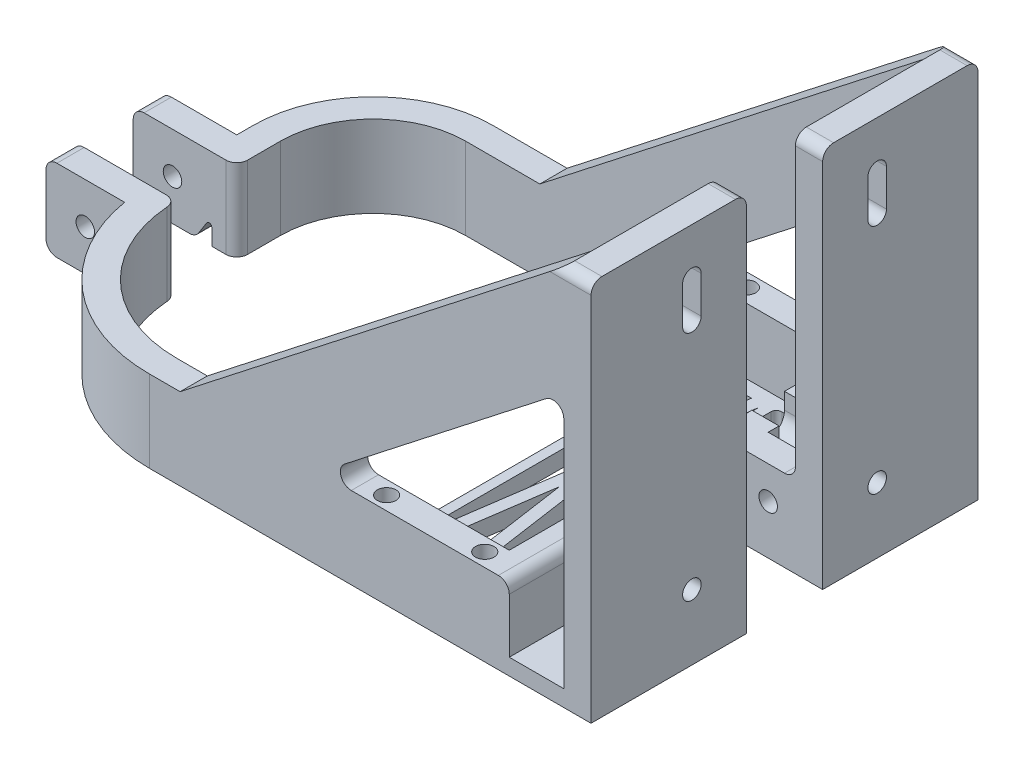
from build123d import *

# Parameters (mm, degrees)
BOSS_EXTRUDE1_DEPTH            = 15
BOSS_EXTRUDE1_2_DEPTH          = 15
BOSS_EXTRUDE2_DEPTH            = 3
CUT_EXTRUDE1_DEPTH             = 73.873177507
CUT_EXTRUDE1_DEPTH_BACK        = 73.873177507
BOSS_EXTRUDE3_START            = -28.5
BOSS_EXTRUDE3_DEPTH            = 28.5
BOSS_EXTRUDE4_DEPTH            = 5
CUT_EXTRUDE2_REACH             = 149.598
SKETCH10_R                     = 1.7
CUT_EXTRUDE2_DIRECTION_2_DEPTH = 148.598272348
MIRROR1_START                  = 57.5
MIRROR1_OUTLINE_W              = 70
MIRROR1_OUTLINE_H              = 42.5
MIRROR1_OUTLINE_R              = 1.7
MIRROR1_DEPTH                  = 5
MIRROR1_START_2                = 47.5
MIRROR1_2_OUTLINE_W            = 3
MIRROR1_2_OUTLINE_H            = 23.5
MIRROR1_2_OUTLINE_H_2          = 14
MIRROR1_2_DEPTH                = 10
MIRROR1_START_3                = -35.5
MIRROR1_3_DEPTH                = 5
CUT_EXTRUDE3_REACH             = 149.598
CUT_EXTRUDE3_DIRECTION_2_DEPTH = 148.598272348
CUT_EXTRUDE4_REACH             = 133.093
CUT_EXTRUDE4_DIRECTION_2_DEPTH = 1
F_2MMFILLET_R                  = 2
F_1MMFILLET_R                  = 1
CUT_EXTRUDE5_DEPTH             = 105.509568001
CUT_EXTRUDE5_DEPTH_BACK        = 105.509568001
SKETCH13_R                     = 1.7
FILLET4_R                      = 2
SKETCH14_R                     = 1.7
CUT_EXTRUDE6_DEPTH             = 15


with BuildPart() as part:
    # Sketch1 → Boss-Extrude1 (new body)
    with BuildSketch(Plane(origin=(0, 0, 0), x_dir=(1, 0, 0), z_dir=(0, 1, 0))):
        with BuildLine():
            Line((-43.5, 5.499997868), (-43.5, 13.5))
            ThreePointArc((-43.5, 13.5), (-38.52081528, 25.52081528), (-26.5, 30.5))
            Line((-26.5, 30.5), (0, 30.5))
            Line((0, 30.5), (42.5, 30.5))
            Line((42.5, 30.5), (42.5, 7))
            Line((42.5, 7), (43.5, 7))
            Line((43.5, 7), (57.5, 7))
            Line((57.5, 7), (57.5, 12))
            Line((57.5, 12), (47.5, 12))
            Line((47.5, 12), (47.5, 35.5))
            Line((47.5, 35.5), (0, 35.5))
            Line((0, 35.5), (-26.5, 35.5))
            ThreePointArc((-26.5, 35.5), (-42.056349186, 29.056349186), (-48.5, 13.5))
            Line((-48.5, 13.5), (-48.5, 10.499997868))
            Line((-48.5, 10.499997868), (-62.5, 10.499997868))
            Line((-62.5, 10.499997868), (-62.5, 5.499997868))
            Line((-62.5, 5.499997868), (-48.5, 5.499997868))
            Line((-48.5, 5.499997868), (-43.5, 5.499997868))
        make_face()
    extrude(amount=BOSS_EXTRUDE1_DEPTH)



with BuildPart() as body_2:
    # Sketch1 → Boss-Extrude1 2 (new body)
    with BuildSketch(Plane(origin=(0, 0, 0), x_dir=(1, 0, 0), z_dir=(0, 1, 0))):
        with BuildLine():
            Line((42.5, -7), (42.5, -30.5))
            Line((42.5, -30.5), (0, -30.5))
            Line((0, -30.5), (-18.5, -30.5))
            ThreePointArc((-18.5, -30.5), (-36.177670284, -23.177668776), (-43.5, -5.499997868))
            Line((-43.5, -5.499997868), (-48.5, -5.499997441))
            Line((-48.5, -5.499997441), (-62.5, -5.499997868))
            Line((-62.5, -5.499997868), (-62.5, -10.499997868))
            Line((-62.5, -10.499997868), (-48.5, -10.499997868))
            Line((-48.5, -10.499997868), (-48.080399276, -10.499997868))
            ThreePointArc((-48.080399276, -10.499997868), (-37.864917557, -28.412877777), (-18.5, -35.5))
            Line((-18.5, -35.5), (0, -35.5))
            Line((0, -35.5), (47.5, -35.5))
            Line((47.5, -35.5), (47.5, -12))
            Line((47.5, -12), (57.5, -12))
            Line((57.5, -12), (57.5, -7))
            Line((57.5, -7), (43.5, -7))
            Line((43.5, -7), (42.5, -7))
        make_face()
    extrude(amount=BOSS_EXTRUDE1_2_DEPTH)


with BuildPart() as part_1:
    add(part.part)

    add(body_2.part)  # Boss-Extrude2 merges body 2
    # Sketch2 → Boss-Extrude2 (add)
    with BuildSketch(Plane(origin=(0, 0, 0), x_dir=(1, 0, 0), z_dir=(0, 1, 0))):
        with BuildLine():
            Line((40.5, -28.5), (32.5, -28.5))
            Line((32.5, -28.5), (32.5, 28.5))
            Line((32.5, 28.5), (40.5, 28.5))
            Line((40.5, 28.5), (40.5, 7))
            Line((40.5, 7), (42.5, 7))
            Line((42.5, 7), (42.5, 30.5))
            Line((42.5, 30.5), (7.5, 30.5))
            Line((7.5, 30.5), (17.5, 28))
            Line((17.5, 28), (17.5, -28.5))
            Line((17.5, -28.5), (-17.5, -28.5))
            ThreePointArc((-17.5, -28.5), (-26.470562378, -26.677447143), (-34.018685261, -21.498786191))
            Line((-34.018685261, -21.498786191), (-35.862976187, -23.486857923))
            ThreePointArc((-35.862976187, -23.486857923), (-27.862920269, -28.680503101), (-18.5, -30.5))
            Line((-18.5, -30.5), (7.5, -30.5))
            Line((7.5, -30.5), (42.5, -30.5))
            Line((42.5, -30.5), (42.5, -7))
            Line((42.5, -7), (40.5, -7))
            Line((40.5, -7), (40.5, -28.5))
        make_face()
    extrude(amount=BOSS_EXTRUDE2_DEPTH)

    # Sketch5 → Cut-Extrude1 (cut, two sides: drawn at the far end of the back side and taken through both)
    with BuildSketch(Plane(origin=(0, 3, 0), x_dir=(1, 0, 0), z_dir=(0, 1, 0)).offset(-CUT_EXTRUDE1_DEPTH_BACK)):
        Polygon((23.254100065, -0.25), (19.3, 27), (19.3, -27.5), align=None)
        Polygon((21.435473806, 27.874767456), (25, 3.309547254), (28.564526194, 27.874767456), align=None)
        Polygon((21.435473806, -28.374767456), (25, -3.809547254), (28.564526194, -28.374767456), align=None)
        Polygon((30.7, -27.5), (26.745899935, -0.25), (30.7, 27), align=None)
    extrude(amount=CUT_EXTRUDE1_DEPTH + CUT_EXTRUDE1_DEPTH_BACK, mode=Mode.SUBTRACT)

    # Sketch6 → Boss-Extrude3 (add)
    with BuildSketch(Plane.XY.offset(35.5).offset(BOSS_EXTRUDE3_START)):
        Polygon((47.5, 0), (62.5, 0), (62.5, 70), (57.5, 70), (57.5, 3), (47.5, 3), align=None)
    extrude(amount=BOSS_EXTRUDE3_DEPTH)

    # Sketch7 → Boss-Extrude4 (add)
    with BuildSketch(Plane.XY.offset(35.5)):
        Polygon((-12.896789771, 15), (57.5, 70), (57.5, 50), (12.702042873, 15), align=None)
    extrude(amount=-BOSS_EXTRUDE4_DEPTH)

    # Sketch10 → Cut-Extrude2 (cut, up to next)
    with BuildSketch(Plane(origin=(62.5, 0, 0), x_dir=(0, 0, -1), z_dir=(1, 0, 0)), mode=Mode.PRIVATE) as cut_extrude2_sk1:
        with Locations(Location((-17, 12, 0), (0, 0, 180))):
            Circle(SKETCH10_R)
    cut_extrude2_tool1 = extrude(cut_extrude2_sk1.sketch, amount=-CUT_EXTRUDE2_REACH, mode=Mode.PRIVATE) & part_1.part
    # Sketch10 → Cut-Extrude2 (cut, up to next)
    with BuildSketch(Plane(origin=(62.5, 0, 0), x_dir=(0, 0, -1), z_dir=(1, 0, 0)), mode=Mode.PRIVATE) as cut_extrude2_sk2:
        with BuildLine():
            Line((-18.7, 61.4), (-18.7, 54.6))
            ThreePointArc((-18.7, 54.6), (-17, 52.9), (-15.3, 54.6))
            Line((-15.3, 54.6), (-15.3, 61.4))
            ThreePointArc((-15.3, 61.4), (-17, 63.1), (-18.7, 61.4))
        make_face()
    cut_extrude2_tool2 = extrude(cut_extrude2_sk2.sketch, amount=-CUT_EXTRUDE2_REACH, mode=Mode.PRIVATE) & part_1.part
    add(cut_extrude2_tool1.solids().sort_by_distance((62.5, 12, 17))[0], mode=Mode.SUBTRACT)
    add(cut_extrude2_tool2.solids().sort_by_distance((62.5, 58, 17))[0], mode=Mode.SUBTRACT)

    # Sketch10 → Cut-Extrude2 direction 2 (cut)
    with BuildSketch(Plane(origin=(62.5, 0, 0), x_dir=(0, 0, -1), z_dir=(1, 0, 0))):
        with Locations(Location((-17, 12, 0), (0, 0, 180))):
            Circle(SKETCH10_R)
        with BuildLine():
            Line((-18.7, 61.4), (-18.7, 54.6))
            ThreePointArc((-18.7, 54.6), (-17, 52.9), (-15.3, 54.6))
            Line((-15.3, 54.6), (-15.3, 61.4))
            ThreePointArc((-15.3, 61.4), (-17, 63.1), (-18.7, 61.4))
        make_face()
    extrude(amount=CUT_EXTRUDE2_DIRECTION_2_DEPTH, mode=Mode.SUBTRACT)

    # Mirror1: read off the stored shape, not the designer's step
    # Mirror1 outline → Mirror1 (add)
    with BuildSketch(Plane.YZ.offset(MIRROR1_START)):
        with Locations((35, -14.25)):
            Rectangle(MIRROR1_OUTLINE_W, MIRROR1_OUTLINE_H)
        with Locations((12, -17)):
            Circle(MIRROR1_OUTLINE_R, mode=Mode.SUBTRACT)
        with BuildLine():
            ThreePointArc((54.6, -18.7), (52.9, -17), (54.6, -15.3))
            Line((54.6, -15.3), (61.4, -15.3))
            ThreePointArc((61.4, -15.3), (63.1, -17), (61.4, -18.7))
            Line((61.4, -18.7), (54.6, -18.7))
        make_face(mode=Mode.SUBTRACT)
    extrude(amount=MIRROR1_DEPTH)

    # Mirror1 2 outline → Mirror1 2 (add)
    with BuildSketch(Plane.YZ.offset(MIRROR1_START_2)):
        with Locations((1.5, -23.75)):
            Rectangle(MIRROR1_2_OUTLINE_W, MIRROR1_2_OUTLINE_H)
        with Locations((1.5, 0)):
            Rectangle(MIRROR1_2_OUTLINE_W, MIRROR1_2_OUTLINE_H_2)
    extrude(amount=MIRROR1_2_DEPTH)

    # Mirror1 3 outline → Mirror1 3 (add)
    with BuildSketch(Plane.XY.offset(MIRROR1_START_3)):
        Polygon((57.5, 70), (-12.896789771, 15), (12.702042873, 15), (57.5, 50), align=None)
    extrude(amount=MIRROR1_3_DEPTH)

    # Sketch11 → Cut-Extrude3 (cut, up to next)
    with BuildSketch(Plane(origin=(62.5, 0, 0), x_dir=(0, 0, -1), z_dir=(1, 0, 0)), mode=Mode.PRIVATE) as cut_extrude3_sk1:
        Polygon((-7, 70), (-7, 0), (0, 0), (7, 0), (7, 70), (0, 70), align=None)
    cut_extrude3_tool1 = extrude(cut_extrude3_sk1.sketch, amount=-CUT_EXTRUDE3_REACH, mode=Mode.PRIVATE) & part_1.part
    add(cut_extrude3_tool1.solids().sort_by_distance((62.5, 35, 0))[0], mode=Mode.SUBTRACT)

    # Sketch11 → Cut-Extrude3 direction 2 (cut)
    with BuildSketch(Plane(origin=(62.5, 0, 0), x_dir=(0, 0, -1), z_dir=(1, 0, 0))):
        Polygon((-7, 70), (-7, 0), (0, 0), (7, 0), (7, 70), (0, 70), align=None)
    extrude(amount=CUT_EXTRUDE3_DIRECTION_2_DEPTH, mode=Mode.SUBTRACT)

    # Sketch12 → Cut-Extrude4 (cut, up to next)
    with BuildSketch(Plane.ZY.offset(-42.5), mode=Mode.PRIVATE) as cut_extrude4_sk1:
        with BuildLine():
            Line((-20, 12), (-20, 15))
            Line((-20, 15), (-14, 15))
            Line((-14, 15), (-14, 12))
            ThreePointArc((-14, 12), (-17, 9), (-20, 12))
        make_face()
    cut_extrude4_tool1 = extrude(cut_extrude4_sk1.sketch, amount=-CUT_EXTRUDE4_REACH, mode=Mode.PRIVATE) & part_1.part
    # Sketch12 → Cut-Extrude4 (cut, up to next)
    with BuildSketch(Plane.ZY.offset(-42.5), mode=Mode.PRIVATE) as cut_extrude4_sk2:
        with BuildLine():
            Line((14, 12), (14, 15))
            Line((14, 15), (20, 15))
            Line((20, 15), (20, 12))
            ThreePointArc((20, 12), (17, 9), (14, 12))
        make_face()
    cut_extrude4_tool2 = extrude(cut_extrude4_sk2.sketch, amount=-CUT_EXTRUDE4_REACH, mode=Mode.PRIVATE) & part_1.part
    add(cut_extrude4_tool1.solids().sort_by_distance((42.5, 12.28005, -17))[0], mode=Mode.SUBTRACT)
    add(cut_extrude4_tool2.solids().sort_by_distance((42.5, 12.28005, 17))[0], mode=Mode.SUBTRACT)

    # Sketch12 → Cut-Extrude4 direction 2 (cut)
    with BuildSketch(Plane.ZY.offset(-42.5)):
        with BuildLine():
            Line((-20, 12), (-20, 15))
            Line((-20, 15), (-14, 15))
            Line((-14, 15), (-14, 12))
            ThreePointArc((-14, 12), (-17, 9), (-20, 12))
        make_face()
        with BuildLine():
            Line((14, 12), (14, 15))
            Line((14, 15), (20, 15))
            Line((20, 15), (20, 12))
            ThreePointArc((20, 12), (17, 9), (14, 12))
        make_face()
    extrude(amount=CUT_EXTRUDE4_DIRECTION_2_DEPTH, mode=Mode.SUBTRACT)

    # 2mmFillet
    f_2mmfillet_edges = [part_1.edges().sort_by_distance(p)[0] for p in [
        (60, 70, 35.5),
        (12.702042873, 15, 33),
        (57.5, 50, 33),
        (60, 70, -35.5),
        (12.702042873, 15, -33),
        (57.5, 50, -33),
        (-43.5, 7.5, -5.499997868),
        (42.5, 9, -7),
        (60, 70, 7),
        (60, 70, -7),
        (47.5, 15, -27.75),
        (-43.5, 7.5, 5.499997868),
        (42.5, 9, 7),
        (47.5, 15, 27.75),
    ]]
    fillet(f_2mmfillet_edges, radius=F_2MMFILLET_R)

    # 1mmFillet
    f_1mmfillet_edges = [part_1.edges().sort_by_distance(p)[0] for p in [
        (40.5, 1.5, 7),
        (40.5, 1.5, 28.5),
        (32.5, 1.5, 28.5),
        (32.5, 1.5, -28.5),
        (40.5, 1.5, -28.5),
        (40.5, 1.5, -7),
        (17.5, 1.5, -28),
        (17.5, 1.5, 28.5),
        (-34.018685261, 1.5, 21.498786191),
    ]]
    fillet(f_1mmfillet_edges, radius=F_1MMFILLET_R)

    # Sketch13 → Cut-Extrude5 (cut, two sides: drawn at the far end of the back side and taken through both)
    with BuildSketch(Plane.XY.offset(10.499997868).offset(-CUT_EXTRUDE5_DEPTH_BACK)):
        with Locations((-55.290199638, 7.5)):
            Circle(SKETCH13_R)
        with Locations((52.5, 9)):
            Circle(SKETCH13_R)
        with BuildLine():
            Line((-48.080399276, 0), (-48.080399276, 3))
            ThreePointArc((-48.080399276, 3), (-48.440696724, 3.480086656), (-49.002332064, 3.268277323))
            Line((-49.002332064, 3.268277323), (-51.080399276, 0))
            Line((-51.080399276, 0), (-48.080399276, 0))
        make_face()
    extrude(amount=CUT_EXTRUDE5_DEPTH + CUT_EXTRUDE5_DEPTH_BACK, mode=Mode.SUBTRACT)

    # Fillet4
    fillet4_edges = [part_1.edges().sort_by_distance(p)[0] for p in [
        (-62.5, 0, -7.999997868),
        (57.5, 15, -9.5),
        (-62.5, 15, -7.999997868),
        (-51.080399276, 0, -7.999997868),
        (-51.080399276, 0, 7.999997694),
        (-62.5, 0, 7.999997868),
        (-62.5, 15, 7.999997868),
        (57.5, 15, 9.5),
    ]]
    fillet(fillet4_edges, radius=FILLET4_R)

    # Sketch14 → Cut-Extrude6 (cut)
    with BuildSketch(Plane.XZ):
        with Locations(Location((22.5, 33, 0), (0, 0, 270))):
            Circle(SKETCH14_R)
        with Locations(Location((40.5, 33, 0), (0, 0, 270))):
            Circle(SKETCH14_R)
        with Locations(Location((40.5, -33, 0), (0, 0, 90))):
            Circle(SKETCH14_R)
        with Locations(Location((22.5, -33, 0), (0, 0, 90))):
            Circle(SKETCH14_R)
    extrude(amount=-CUT_EXTRUDE6_DEPTH, mode=Mode.SUBTRACT)


solid = part_1.part
